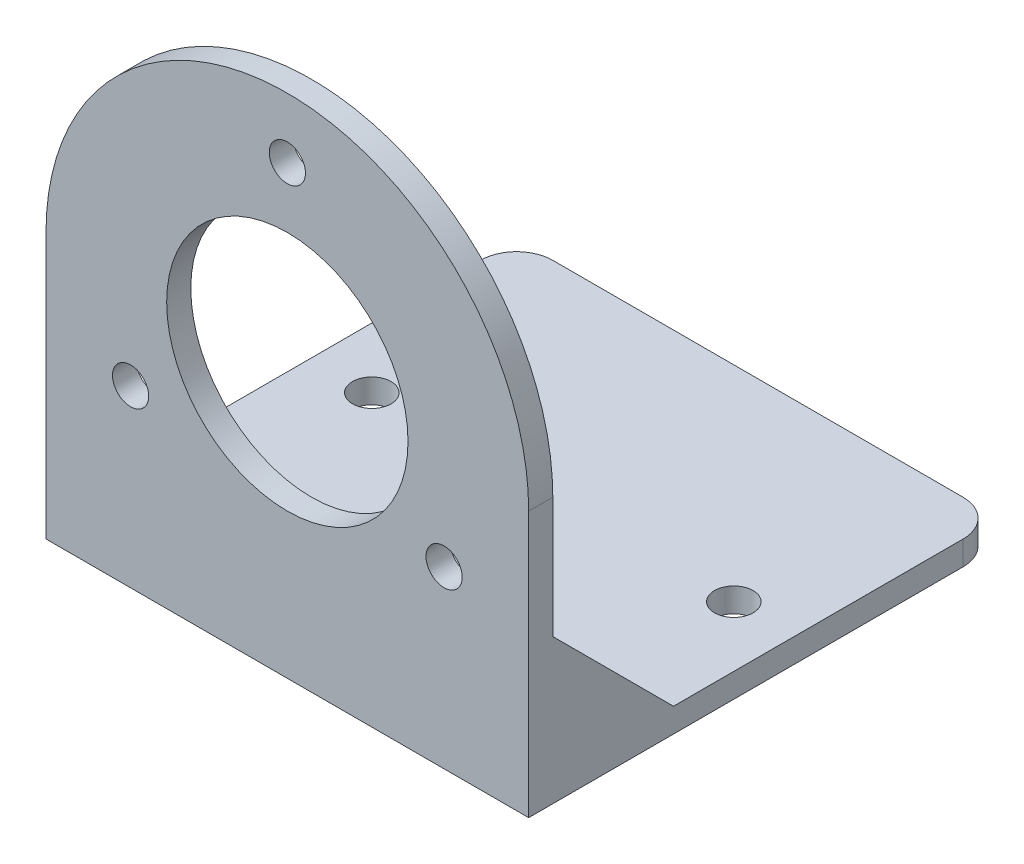
from build123d import *

# Parameters (mm, degrees)
SKETCH1_R           = 1.5
SKETCH1_R_2         = 10
BOSS_EXTRUDE1_DEPTH = 2
SKETCH2_W           = 40
SKETCH2_H           = 2
BOSS_EXTRUDE2_DEPTH = 37
FILLET1_R           = 3
SKETCH3_R           = 1.6
CUT_EXTRUDE1_DEPTH  = 59.043087444
RIB2_DEPTH          = 1.5


# Read off the part's stored shape, not the designer's step: Rib2
with BuildPart() as part:
    # Sketch1 → Boss-Extrude1 (new body)
    with BuildSketch(Plane.XY):
        with BuildLine():
            Line((-20, 0), (-20, -22))
            Line((-20, -22), (20, -22))
            Line((20, -22), (20, 0))
            ThreePointArc((20, 0), (0, 20), (-20, 0))
        make_face()
        with Locations((0, 15)):
            Circle(SKETCH1_R, mode=Mode.SUBTRACT)
        with Locations((12.990381057, -7.5)):
            Circle(SKETCH1_R, mode=Mode.SUBTRACT)
        with Locations((-12.990381057, -7.5)):
            Circle(SKETCH1_R, mode=Mode.SUBTRACT)
        Circle(SKETCH1_R_2, mode=Mode.SUBTRACT)
    extrude(amount=BOSS_EXTRUDE1_DEPTH)

    # Sketch2 → Boss-Extrude2 (add)
    with BuildSketch(Plane(origin=(0, 0, 0), x_dir=(-1, 0, 0), z_dir=(0, 0, -1))):
        with Locations((0, -21)):
            Rectangle(SKETCH2_W, SKETCH2_H)
    extrude(amount=BOSS_EXTRUDE2_DEPTH)

    # Fillet1
    fillet1_edges = [part.edges().sort_by_distance(p)[0] for p in [
        (-20, -21, -37),
        (20, -21, -37),
    ]]
    fillet(fillet1_edges, radius=FILLET1_R)

    # Sketch3 → Cut-Extrude1 (cut, through all)
    with BuildSketch(Plane(origin=(0, -20, 0), x_dir=(1, 0, 0), z_dir=(0, 1, 0))):
        with Locations(Location((15, 20, 0), (0, 0, 180))):
            Circle(SKETCH3_R)
        with Locations(Location((15, 3, 0), (0, 0, 180))):
            Circle(SKETCH3_R)
        with Locations((-15, 3)):
            Circle(SKETCH3_R)
        with Locations((-15, 20)):
            Circle(SKETCH3_R)
    extrude(amount=-CUT_EXTRUDE1_DEPTH, mode=Mode.SUBTRACT)

    # Rib2 outline → Rib2 (add)
    with BuildSketch(Plane(origin=(-20, 0, 0), x_dir=(0, 0, -1), z_dir=(1, 0, 0))):
        Polygon((10, -20), (0, -10), (0, -20), align=None)
    rib2 = extrude(amount=RIB2_DEPTH)

    # Mirror1: Rib2 across plane
    add(rib2.mirror(Plane(origin=(0, 0, 0), x_dir=(0, 0, 1), z_dir=(1, 0, 0))))


solid = part.part
